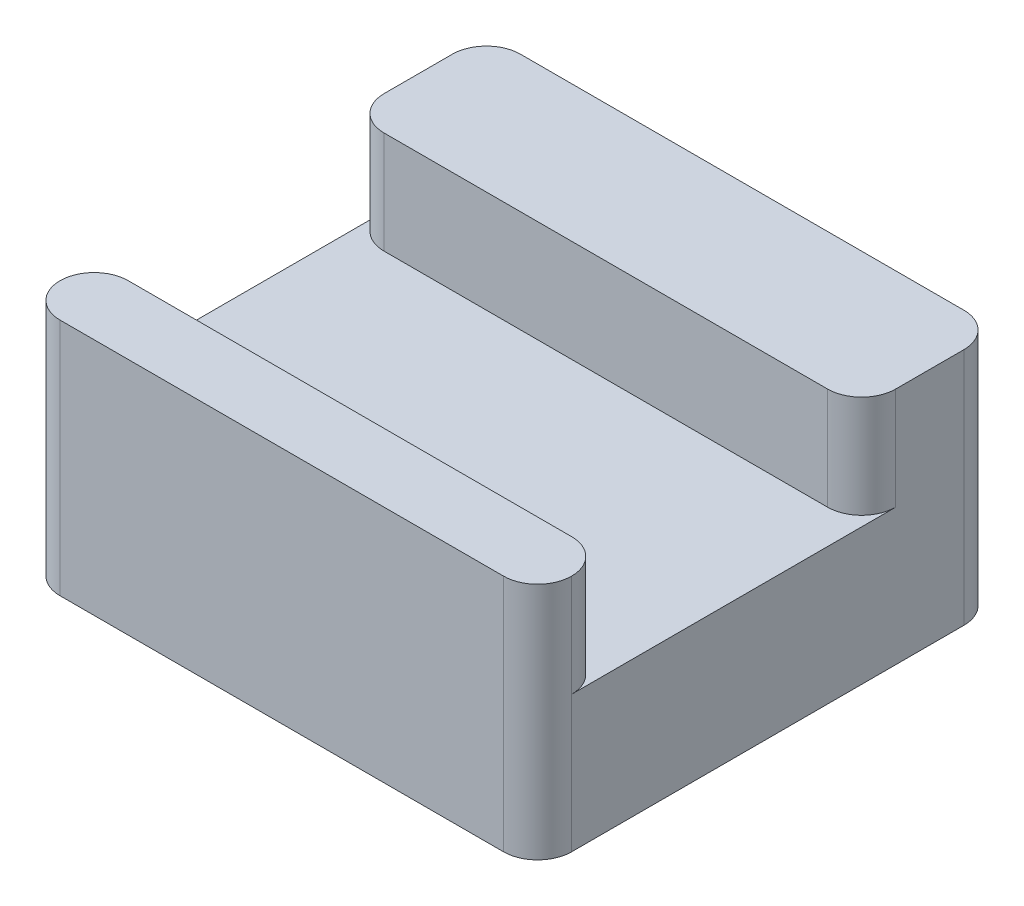
from build123d import *

# Parameters (mm, degrees)
SKETCH1_W           = 15
SKETCH1_H           = 13.5
BOSS_EXTRUDE1_DEPTH = 7
SKETCH2_W           = 15
SKETCH2_H           = 7.5
CUT_EXTRUDE2_DEPTH  = 3
SKETCH3_R           = 1.3
CUT_EXTRUDE3_DEPTH  = 10.5
FILLET1_R           = 1


with BuildPart() as part:
    # Sketch1 → Boss-Extrude1 (new body)
    with BuildSketch(Plane(origin=(0, 0, 0), x_dir=(1, 0, 0), z_dir=(0, 1, 0))):
        Rectangle(SKETCH1_W, SKETCH1_H)
    extrude(amount=BOSS_EXTRUDE1_DEPTH)

    # Sketch2 → Cut-Extrude2 (cut)
    with BuildSketch(Plane(origin=(0, 7, 0), x_dir=(1, 0, 0), z_dir=(0, 1, 0))):
        with Locations((0, -1)):
            Rectangle(SKETCH2_W, SKETCH2_H)
    extrude(amount=-CUT_EXTRUDE2_DEPTH, mode=Mode.SUBTRACT)

    # Sketch3 → Cut-Extrude3 (cut)
    with BuildSketch(Plane(origin=(0, 0, -6.75), x_dir=(-1, 0, 0), z_dir=(0, 0, -1))):
        with Locations((0, 2)):
            Circle(SKETCH3_R)
    extrude(amount=-CUT_EXTRUDE3_DEPTH, mode=Mode.SUBTRACT)

    # Fillet1
    fillet1_edges = [part.edges().sort_by_distance(p)[0] for p in [
        (7.5, 5.5, -2.75),
        (7.5, 5.5, 4.75),
        (-7.5, 5.5, 4.75),
        (-7.5, 5.5, -2.75),
        (7.5, 3.5, 6.75),
        (-7.5, 3.5, 6.75),
        (-7.5, 3.5, -6.75),
        (7.5, 3.5, -6.75),
    ]]
    fillet(fillet1_edges, radius=FILLET1_R - 0.0001)  # a hair under: the kernel refuses the full size


solid = part.part
